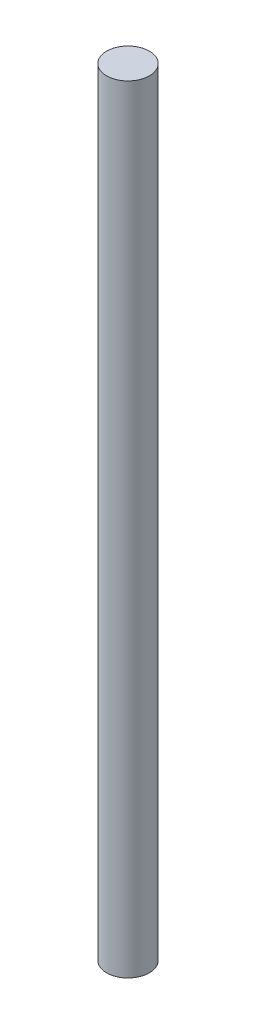
from build123d import *

# Parameters (mm, degrees)
SKETCH_1_R      = 1
EXTRUDE_1_DEPTH = 36.3


with BuildPart() as part:
    # 草图1 → 凸台-拉伸1 (new body)
    with BuildSketch(Plane(origin=(0, 0, 0), x_dir=(1, 0, 0), z_dir=(0, 1, 0))):
        Circle(SKETCH_1_R)
    extrude(amount=EXTRUDE_1_DEPTH)


solid = part.part
